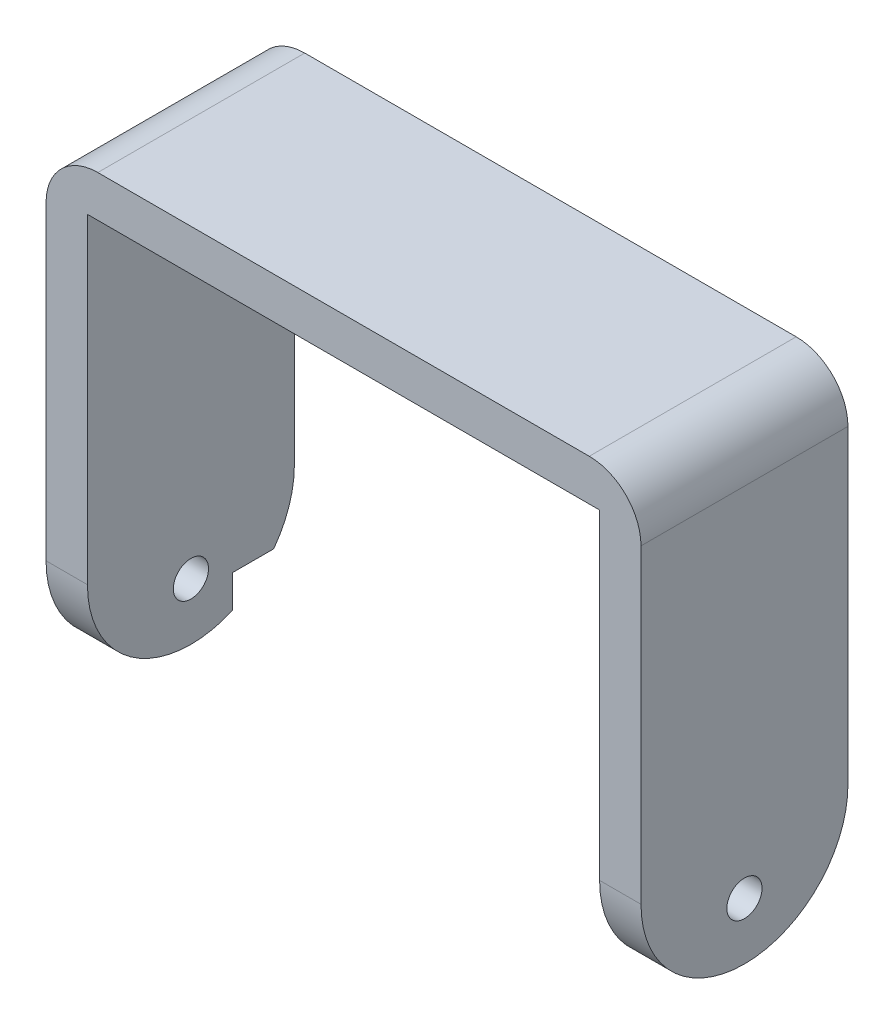
from build123d import *

# Parameters (mm, degrees)
BOSS_EXTRU_1_DEPTH          = 20
ENL_V_MAT_EXTRU_1_REACH     = 77.705
ESQUISSE2_R                 = 1.5
D_GAGEMENT_M31_D            = 3.4
D_GAGEMENT_M31_DEPTH        = 57.5
D_GAGEMENT_M31_TIP          = 1.021463052
CONG_1_R                    = 10
CONG_2_R                    = 5
ENL_V_START                 = 0.83484861
ENL_V_MAT_EXTRU_2_OUTLINE_W = 4
ENL_V_MAT_EXTRU_2_OUTLINE_H = 5
ENL_V_MAT_EXTRU_2_DEPTH     = 3.16515139


# Read off the part's stored shape, not the designer's step: Enlèv. mat.-Extru.2
with BuildPart() as part:
    # Esquisse1 → Boss.-Extru.1 (new body)
    with BuildSketch(Plane.XY):
        Polygon((0, 0), (4, 0), (4, 41), (53.5, 41), (53.5, 0), (57.5, 0), (57.5, 45), (0, 45), align=None)
    extrude(amount=BOSS_EXTRU_1_DEPTH)

    # Enlèv. mat.-Extru.1: up to this face of the body (flat: up to its plane)
    enl_v_mat_extru_1_end = Plane(part.part.faces().sort_by_distance((0, 22.5, 10))[0])
    # Esquisse2 → Enlèv. mat.-Extru.1 (cut, up to the picked face)
    with BuildSketch(Plane(origin=(57.5, 0, 0), x_dir=(0, 0, -1), z_dir=(1, 0, 0)), mode=Mode.PRIVATE) as enl_v_mat_extru_1_sk1:
        with Locations((-10, 5.5)):
            Circle(ESQUISSE2_R)
    enl_v_mat_extru_1_tool1 = split(extrude(enl_v_mat_extru_1_sk1.sketch, amount=-ENL_V_MAT_EXTRU_1_REACH, mode=Mode.PRIVATE), bisect_by=enl_v_mat_extru_1_end, keep=Keep.BOTH, mode=Mode.PRIVATE)
    add(enl_v_mat_extru_1_tool1.solids().sort_by(Axis((57.5, 5.5, 10), (-1, 0, 0)))[0], mode=Mode.SUBTRACT)

    # Dégagement M31
    with Locations(Plane(origin=(57.5, 0, 0), x_dir=(0, 0, -1), z_dir=(1, 0, 0))):
        with Locations((-10, 5.5)):
            Hole(D_GAGEMENT_M31_D / 2, depth=D_GAGEMENT_M31_DEPTH)
            with Locations((0, 0, -(D_GAGEMENT_M31_DEPTH + D_GAGEMENT_M31_TIP / 2))):  # 118° drill point
                Cone(0, D_GAGEMENT_M31_D / 2, D_GAGEMENT_M31_TIP, mode=Mode.SUBTRACT)

    # Congé1
    cong_1_edges = [part.edges().sort_by_distance(p)[0] for p in [
        (55.5, 0, 0),
        (55.5, 0, 20),
        (2, 0, 0),
        (2, 0, 20),
    ]]
    fillet(cong_1_edges, radius=CONG_1_R - 0.0001)  # a hair under: the kernel refuses the full size

    # Congé2
    cong_2_edges = [part.edges().sort_by_distance(p)[0] for p in [
        (0, 45, 10),
        (57.5, 45, 10),
    ]]
    fillet(cong_2_edges, radius=CONG_2_R)

    # Enlèv. mat.-Extru.2 outline → Enlèv. mat.-Extru.2 (cut)
    with BuildSketch(Plane(origin=(0, 0, 0), x_dir=(1, 0, 0), z_dir=(0, 1, 0)).offset(ENL_V_START)):
        with Locations((2, -3.5)):
            Rectangle(ENL_V_MAT_EXTRU_2_OUTLINE_W, ENL_V_MAT_EXTRU_2_OUTLINE_H)
    extrude(amount=ENL_V_MAT_EXTRU_2_DEPTH, mode=Mode.SUBTRACT)


solid = part.part
